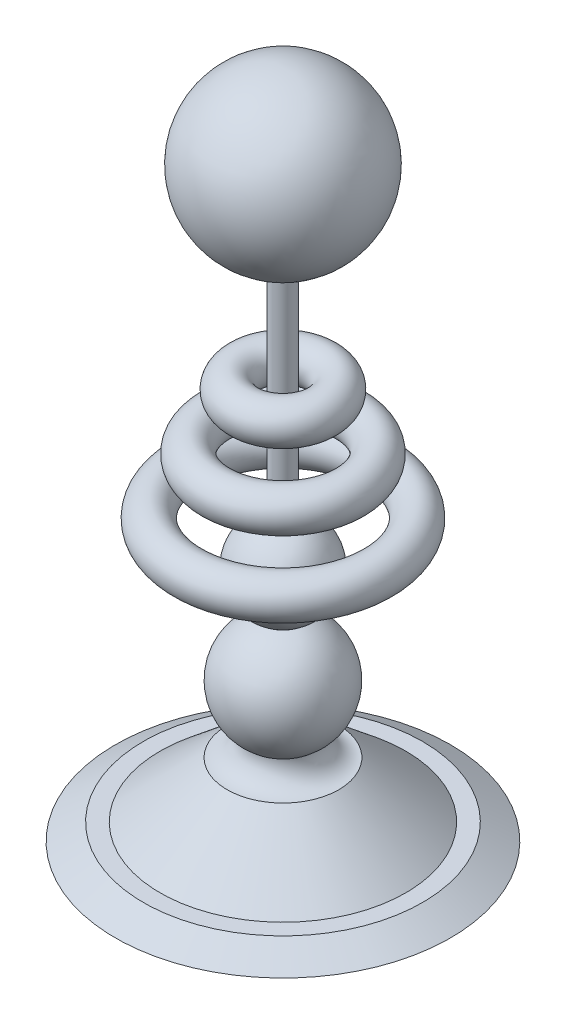
from build123d import *

# Parameters (mm, degrees)
SKETCH_1_R = 3.5
FILLET_3_R = 4


with BuildPart() as part:
    # 草图1 → 旋转1 (revolve)
    with BuildSketch(Plane.XY, mode=Mode.PRIVATE) as revolve_1_sk:
        with BuildLine():
            Line((0, 0), (0, 120))
            ThreePointArc((0, 120), (14.966479733, 106.002239689), (2, 90.133931253))
            Line((2, 90.133931253), (2, 50.289892356))
            ThreePointArc((2, 50.289892356), (8, 42.543925664), (2, 34.797958971))
            ThreePointArc((2, 34.797958971), (9.756630355, 27.192752634), (6, 17))
            Line((6, 17), (6, 13))
            Line((6, 13), (10, 13))
            Line((10, 13), (22, 3))
            Line((22, 3), (25, 3))
            Line((25, 3), (30, 0))
            Line((30, 0), (0, 0))
        make_face()
        with Locations((7, 70.133931253)):
            Circle(SKETCH_1_R)
        with Locations((12, 60.133931253)):
            Circle(SKETCH_1_R)
        with Locations((17, 50.133931253)):
            Circle(SKETCH_1_R)
    revolve(revolve_1_sk.sketch.rotate(Axis((0, 0, 0), (0, 1, 0)), 90), axis=Axis((0, 0, 0), (0, 1, 0)))

    # 圆角3
    fillet_3_edges = [part.edges().sort_by_distance(p)[0] for p in [
        (0, 13, 6),
    ]]
    fillet(fillet_3_edges, radius=FILLET_3_R - 0.0001)  # a hair under: the kernel refuses the full size


solid = part.part
